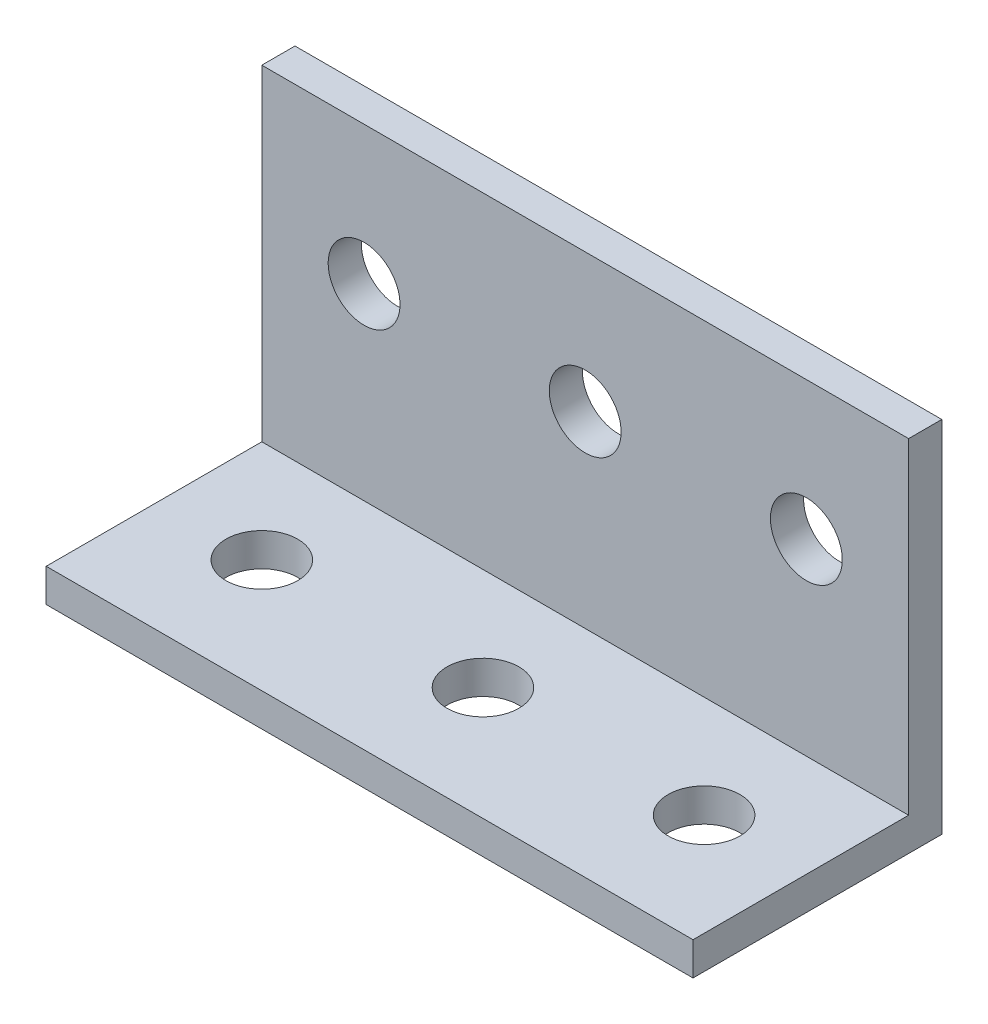
from build123d import *

# Parameters (mm, degrees)
SKETCH_1_W             = 234
SKETCH_1_H             = 130
EXTRUDE_1_DEPTH        = 90
SKETCH_2_W             = 78
SKETCH_2_H             = 118
CUT_EXTRUDE_1_DEPTH    = 283.411047943
SKETCH_3_R             = 13
CUT_EXTRUDE_2_DEPTH    = 283.411047943
PATTERN_LINEAR_1_COUNT = 3
PATTERN_LINEAR_1_PITCH = 80
SKETCH_4_R             = 13
CUT_EXTRUDE_3_DEPTH    = 283.411047943
PATTERN_LINEAR_2_COUNT = 3
PATTERN_LINEAR_2_PITCH = 80


with BuildPart() as part:
    # 草图1 → 凸台-拉伸1 (new body)
    with BuildSketch(Plane.XY):
        with Locations((117, 65)):
            Rectangle(SKETCH_1_W, SKETCH_1_H)
    extrude(amount=EXTRUDE_1_DEPTH)

    # 草图2 → 切除-拉伸1 (cut, through all)
    with BuildSketch(Plane.ZY):
        with Locations((51, 71)):
            Rectangle(SKETCH_2_W, SKETCH_2_H)
    extrude(amount=-CUT_EXTRUDE_1_DEPTH, mode=Mode.SUBTRACT)

    # 草图3 → 切除-拉伸2 (cut, through all)
    with BuildSketch(Plane(origin=(0, 0, 0), x_dir=(-1, 0, 0), z_dir=(0, 0, -1))):
        with Locations((-197, 80)):
            Circle(SKETCH_3_R)
    cut_extrude_2 = extrude(amount=-CUT_EXTRUDE_2_DEPTH, mode=Mode.SUBTRACT)

    # 阵列(线性)1: 切除-拉伸2 ×3
    with Locations(*[(-i * PATTERN_LINEAR_1_PITCH, 0, 0) for i in range(1, PATTERN_LINEAR_1_COUNT)]):
        add(cut_extrude_2, mode=Mode.SUBTRACT)

    # 草图4 → 切除-拉伸3 (cut, through all)
    with BuildSketch(Plane.XZ):
        with Locations((37, 49)):
            Circle(SKETCH_4_R)
    cut_extrude_3 = extrude(amount=-CUT_EXTRUDE_3_DEPTH, mode=Mode.SUBTRACT)

    # 阵列(线性)2: 切除-拉伸3 ×3
    with Locations(*[(i * PATTERN_LINEAR_2_PITCH, 0, 0) for i in range(1, PATTERN_LINEAR_2_COUNT)]):
        add(cut_extrude_3, mode=Mode.SUBTRACT)


solid = part.part
